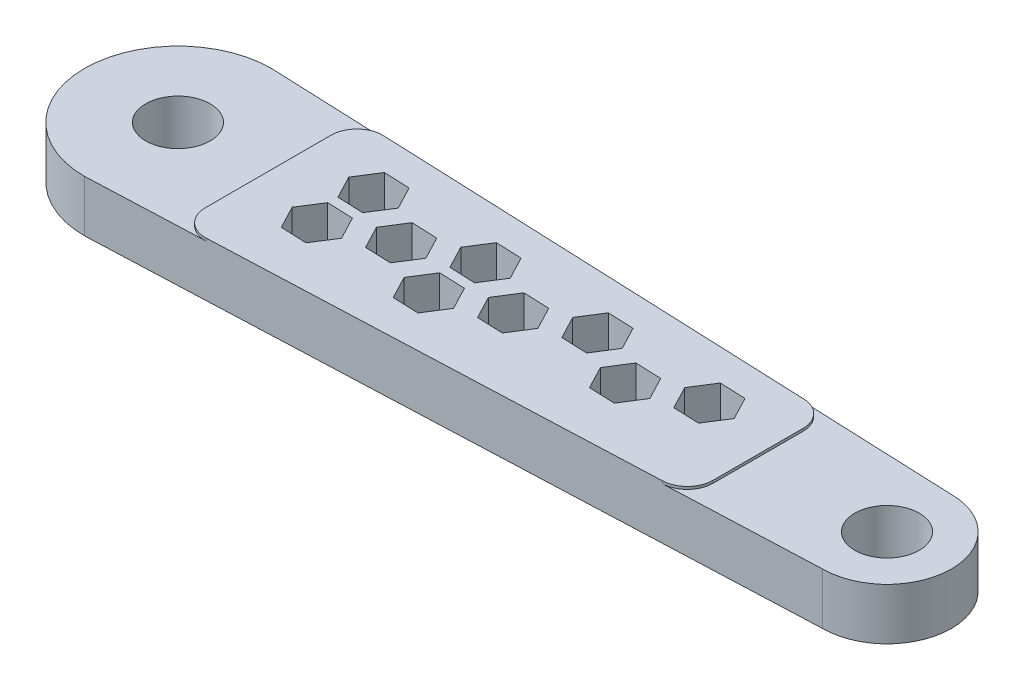
from build123d import *

# Parameters (mm, degrees)
CROQUIS1_R              = 2.5
SALIENTE_EXTRUIR1_DEPTH = 2
SALIENTE_EXTRUIR2_DEPTH = 0.2
PATR_N_START            = -2
PATR_N_DE_RAYADO2_DEPTH = 4.2


# Read off the part's stored shape, not the designer's step: Patrón de rayado2
with BuildPart() as part:
    # Croquis1 → Saliente-Extruir1 (new, symmetric)
    with BuildSketch(Plane(origin=(0, 0, 0), x_dir=(1, 0, 0), z_dir=(0, 1, 0))):
        with BuildLine():
            Line((0, 7.25), (55, 5))
            ThreePointArc((55, 5), (60, 0), (55, -5))
            Line((55, -5), (0, -7.25))
            ThreePointArc((0, -7.25), (-7.25, 0), (0, 7.25))
        make_face()
        with Locations(Location((0, 0, 0), (0, 0, 270))):
            Circle(CROQUIS1_R, mode=Mode.SUBTRACT)
        with Locations(Location((55, 0, 0), (0, 0, 270))):
            Circle(CROQUIS1_R, mode=Mode.SUBTRACT)
    extrude(amount=SALIENTE_EXTRUIR1_DEPTH, both=True)

    # Croquis2 → Saliente-Extruir2 (add)
    with BuildSketch(Plane(origin=(0, 2, 0), x_dir=(1, 0, 0), z_dir=(0, 1, 0))):
        with BuildLine():
            Line((7, 4.880145328), (7, -4.880145328))
            ThreePointArc((7, -4.880145328), (7.614990904, -6.322972346), (9.081749804, -6.878473872))
            Line((9.081749804, -6.878473872), (43.081749804, -5.487564781))
            ThreePointArc((43.081749804, -5.487564781), (44.442827018, -4.874245333), (45, -3.489236237))
            Line((45, -3.489236237), (45, 3.489236237))
            ThreePointArc((45, 3.489236237), (44.442827018, 4.874245333), (43.081749804, 5.487564781))
            Line((43.081749804, 5.487564781), (9.081749804, 6.878473872))
            ThreePointArc((9.081749804, 6.878473872), (7.614990904, 6.322972346), (7, 4.880145328))
        make_face()
    extrude(amount=SALIENTE_EXTRUIR2_DEPTH)

    # Patrón de rayado2 outline → Patrón de rayado2 (cut)
    with BuildSketch(Plane(origin=(0, 0, 0), x_dir=(1, 0, 0), z_dir=(0, 1, 0)).offset(PATR_N_START)):
        Polygon((10.504788453, 2.748868179), (11.433155318, 0.977389992), (13.431483862, 0.895640188), (14.501445541, 2.585368571), (13.573078676, 4.356846757), (11.574750132, 4.438596561), align=None)
        Polygon((20.48865892, 0.606937572), (22.486987464, 0.525187768), (23.556949143, 2.21491615), (22.628582278, 3.986394337), (20.630253734, 4.068144141), (19.560292055, 2.378415759), align=None)
        Polygon((29.544162522, 0.236485152), (31.542491066, 0.154735348), (32.612452745, 1.84446373), (31.68408588, 3.615941917), (29.685757336, 3.697691721), (28.615795657, 2.007963338), align=None)
        Polygon((38.599666124, -0.133967268), (40.597994668, -0.215717072), (41.667956347, 1.47401131), (40.739589483, 3.245489496), (38.741260939, 3.327239301), (37.67129926, 1.637510918), align=None)
        Polygon((19.387547255, -1.84423492), (20.31591412, -3.615713106), (22.314242664, -3.69746291), (23.384204343, -2.007734528), (22.455837478, -0.236256342), (20.457508934, -0.154506537), align=None)
        Polygon((11.260410517, -3.245260686), (13.258739061, -3.32701049), (14.32870074, -1.637282108), (13.400333876, 0.134196079), (11.402005332, 0.215945883), (10.332043653, -1.473782499), align=None)
        Polygon((33.057175058, -0.288588211), (33.985541923, -2.060066397), (35.983870467, -2.141816201), (37.053832146, -0.452087819), (36.125465281, 1.319390367), (34.127136737, 1.401140171), align=None)
        Polygon((24.930038321, -1.689613977), (26.928366865, -1.771363781), (27.998328544, -0.081635399), (27.069961679, 1.689842788), (25.071633135, 1.771592592), (24.001671456, 0.081864209), align=None)
        Polygon((15.874534719, -1.319161557), (17.872863263, -1.400911361), (18.942824942, 0.288817021), (18.014458077, 2.060295208), (16.016129533, 2.142045012), (14.946167854, 0.45231663), align=None)
    extrude(amount=PATR_N_DE_RAYADO2_DEPTH, mode=Mode.SUBTRACT)


solid = part.part
